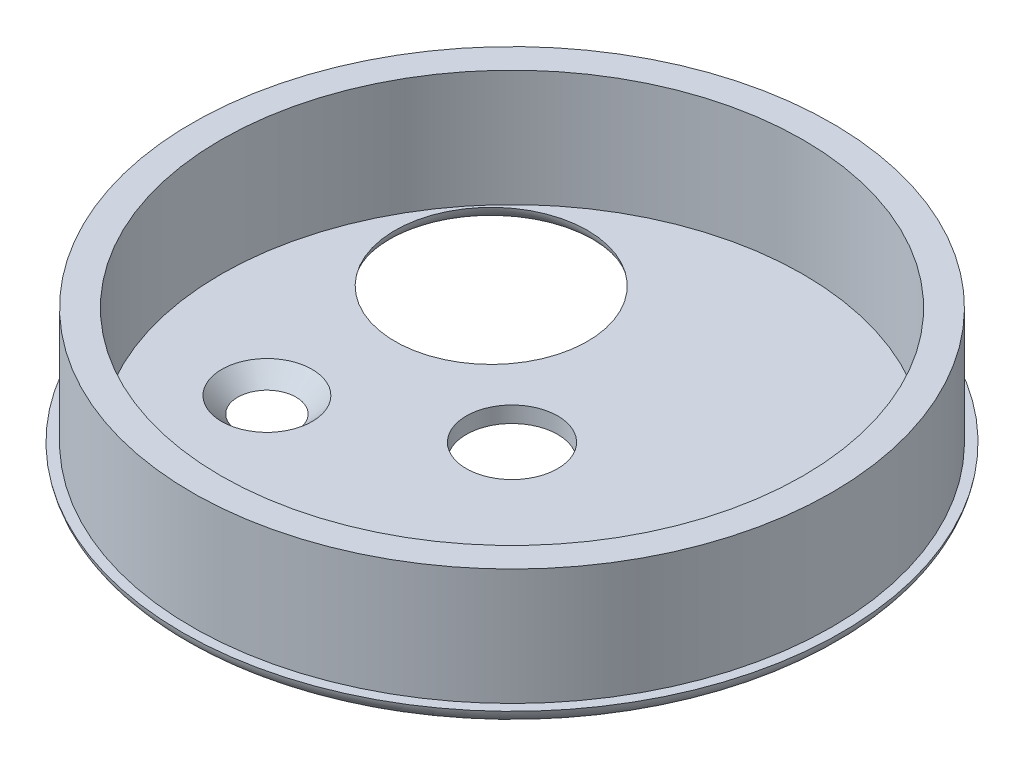
from build123d import *

# Parameters (mm, degrees)
SKETCH1_R           = 33.25
SKETCH1_R_2         = 30.25
EXTRUDE_THIN5_DEPTH = 12.1
SKETCH2_R           = 34.25
BOSS_EXTRUDE1_DEPTH = 1.67
SKETCH3_R           = 4.75
CUT_EXTRUDE1_DEPTH  = 2
SKETCH6_R           = 10
CUT_EXTRUDE4_DEPTH  = 2
FILLET1_R           = 2
FILLET2_R           = 2
SKETCH13_R          = 1.75
CUT_EXTRUDE6_DEPTH  = 5


# Read off the part's stored shape, not the designer's step: CSK for M4 Countersunk Flat Head Screw1
with BuildPart() as part:
    # Sketch1 → Extrude-Thin5 (new body)
    with BuildSketch(Plane(origin=(0, 0, 0), x_dir=(1, 0, 0), z_dir=(0, 1, 0))):
        Circle(SKETCH1_R)
        Circle(SKETCH1_R_2, mode=Mode.SUBTRACT)
    extrude(amount=EXTRUDE_THIN5_DEPTH)

    # Sketch2 → Boss-Extrude1 (add)
    with BuildSketch(Plane.XZ):
        with Locations(Location((0, 0, 0), (0, 0, 270))):
            Circle(SKETCH2_R)
    extrude(amount=BOSS_EXTRUDE1_DEPTH)

    # Sketch3 → Cut-Extrude1 (cut)
    with BuildSketch(Plane.XZ.offset(1.67)):
        with Locations(Location((0, 0, 0), (0, 0, 270))):
            Circle(SKETCH3_R)
    extrude(amount=-CUT_EXTRUDE1_DEPTH, mode=Mode.SUBTRACT)

    # Sketch6 → Cut-Extrude4 (cut)
    with BuildSketch(Plane.XZ.offset(1.67)):
        with Locations(Location((-15.156619939, -12.99647525, 0), (0, 0, 270))):
            Circle(SKETCH6_R)
    extrude(amount=-CUT_EXTRUDE4_DEPTH, mode=Mode.SUBTRACT)

    # Fillet1
    # the kernel refuses this fillet: 2 mm, written as the material it takes off along each edge
    with BuildSketch(Plane(origin=(0, -1.67, 0), x_dir=(0, 0, -1), z_dir=(-1, 0, 0))) as fillet1_piece_1:
        with BuildLine():
            CenterArc((32.277412866, -2), FILLET1_R, 9.497234469, 80.502765531)
            Line((32.277412866, 0), (32.277412866, 0.04))
            Line((32.277412866, 0.04), (34.25, 0.04))
            Line((34.25, 0.04), (34.29, 0))
            ThreePointArc((34.29, 0), (34.29, -0.835), (34.289451743, -1.6634))
            Line((34.289451743, -1.6634), (34.25, -1.67))
        make_face()
    revolve(axis=Axis((0, -1.67, 0), (0, -1, 0)), mode=Mode.SUBTRACT)

    # Fillet2
    # the kernel refuses this fillet: 2 mm, written as the material it takes off along each edge
    with BuildSketch(Plane(origin=(-15.156619939, -1.67, -12.99647525), x_dir=(0, 0, -1), z_dir=(-1, 0, 0))) as fillet2_piece_1:
        with BuildLine():
            CenterArc((11.972587134, -2), FILLET2_R, 90, 80.502765531)
            Line((10, -1.67), (9.960548257, -1.6634))
            ThreePointArc((9.960548257, -1.6634), (9.96, -0.835), (9.96, 0))
            Line((9.96, 0), (10, 0.04))
            Line((10, 0.04), (11.972587134, 0.04))
            Line((11.972587134, 0.04), (11.972587134, 0))
        make_face()
    revolve(axis=Axis((-15.156619939, -1.67, -12.99647525), (0, -1, 0)), mode=Mode.SUBTRACT)

    # Sketch13 → Cut-Extrude6 (cut)
    with BuildSketch(Plane.XZ.offset(1.67)):
        with Locations(Location((-16.950332705, 8.520084869, 0), (0, 0, 270))):
            Circle(SKETCH13_R)
        with Locations(Location((17.965530419, 6.094697839, 0), (0, 0, 270))):
            Circle(SKETCH13_R)
    extrude(amount=-CUT_EXTRUDE6_DEPTH, mode=Mode.SUBTRACT)

    # CSK for M4 Countersunk Flat Head Scr 2 → CSK for M4 Countersunk Flat Head Screw1 (revolve, cut)
    with BuildSketch(Plane(origin=(17.965530419, 0, 6.094697839), x_dir=(1, 0, 0), z_dir=(0, 0, 1))):
        Polygon((4.7, 0), (1.75, 0), (1.75, -1.67), (3.03, -1.67), align=None)
    revolve(axis=Axis((17.965530419, 0, 6.094697839), (0, 1, 0)), mode=Mode.SUBTRACT)

    # CSK for M4 Countersunk Flat Head Scr 3 o → CSK for M4 Countersunk Flat Head Scr 3 (revolve, cut)
    with BuildSketch(Plane(origin=(-16.950332705, 0, 8.520084869), x_dir=(1, 0, 0), z_dir=(0, 0, 1))):
        Polygon((4.7, 0), (1.75, 0), (1.75, -1.67), (3.03, -1.67), align=None)
    revolve(axis=Axis((-16.950332705, 0, 8.520084869), (0, 1, 0)), mode=Mode.SUBTRACT)


solid = part.part
